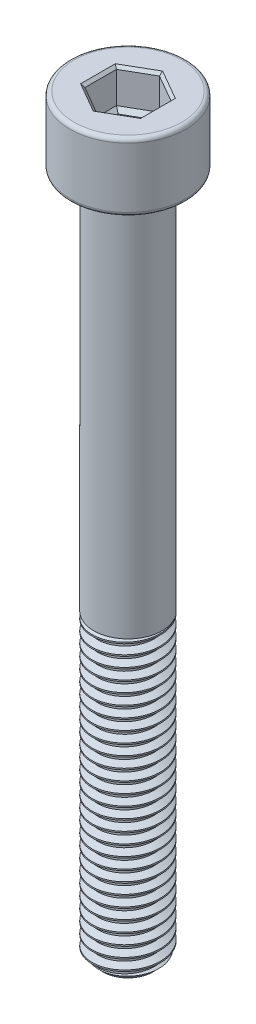
from build123d import *

# Parameters (mm, degrees)
SKETCH1_R           = 2.5
BOSS_EXTRUDE1_DEPTH = 22
THREAD1_PITCH       = 0.8
SKETCH2_R           = 2.5
BOSS_EXTRUDE2_DEPTH = 28
SKETCH3_R           = 4.25
BOSS_EXTRUDE3_DEPTH = 5
FILLET1_R           = 0.3
CUT_EXTRUDE1_DEPTH  = 2.5
CHAMFER1_SIZE       = 0.2
CUT_EXTRUDE2_DEPTH  = 0.3
CUT_EXTRUDE2_DRAFT  = -45


with BuildPart() as part:
    # Sketch1 → Boss-Extrude1 (new body)
    with BuildSketch(Plane(origin=(0, 0, 0), x_dir=(1, 0, 0), z_dir=(0, 1, 0))):
        with Locations(Location((0, 0, 0), (0, 0, 270))):
            Circle(SKETCH1_R)
    extrude(amount=BOSS_EXTRUDE1_DEPTH)

    # Thread1: the profile of Thread Profile1 profile screwed along a right-hand helix of 28.75 turns, 8 arcs to a turn; built about Z, then put on its axis
    thread1_z = Axis((0, 0, 0), (0, 0, 1))
    thread1_corners = [(2.5003, 0, -0.000173205), (2.5003, 0, 0.700173203), (2.0669873, 0, 0.449999999), (2.0669873, 0, 0.249999999)]
    with BuildLine(mode=Mode.PRIVATE) as thread1_profile:
        Line(thread1_corners[0], thread1_corners[1])
        Line(thread1_corners[1], thread1_corners[2])
        Line(thread1_corners[2], thread1_corners[3])
        Line(thread1_corners[3], thread1_corners[0])
    thread1_cap = Face(thread1_profile.wire())
    thread1_turn_angles = [0, 22.5, 45, 67.5, 90, 112.5, 135, 157.5, 180, 202.5, 225, 247.5, 270, 292.5, 315, 337.5, 360]
    thread1_turn_weights = [1, 0.9238795325112867, 1, 0.9238795325112867, 1, 0.9238795325112867, 1, 0.9238795325112867, 1, 0.9238795325112867, 1, 0.9238795325112867, 1, 0.9238795325112867, 1, 0.9238795325112867, 1]
    thread1_turn_rails = [Edge.make_bspline([Vector(p[0], p[1], 0).rotate(thread1_z, thread1_turn_angles[k]) / thread1_turn_weights[k] + Vector(0, 0, p[2] + THREAD1_PITCH * thread1_turn_angles[k] / 360) for k in range(17)], [0, 0, 0, 1, 1, 2, 2, 3, 3, 4, 4, 5, 5, 6, 6, 7, 7, 8, 8, 8], 2, thread1_turn_weights) for p in thread1_corners]
    thread1_turn_sides = [Face.make_surface_from_curves(thread1_turn_rails[p[0]], thread1_turn_rails[p[1]]) for p in [(0, 1), (1, 2), (2, 3), (3, 0)]]
    thread1_last_angles = [10080, 10102.5, 10125, 10147.5, 10170, 10192.5, 10215, 10237.5, 10260, 10282.5, 10305, 10327.5, 10350]
    thread1_last_weights = [1, 0.9238795325112867, 1, 0.9238795325112867, 1, 0.9238795325112867, 1, 0.9238795325112867, 1, 0.9238795325112867, 1, 0.9238795325112867, 1]
    thread1_last_rails = [Edge.make_bspline([Vector(p[0], p[1], 0).rotate(thread1_z, thread1_last_angles[k]) / thread1_last_weights[k] + Vector(0, 0, p[2] + THREAD1_PITCH * thread1_last_angles[k] / 360) for k in range(13)], [0, 0, 0, 1, 1, 2, 2, 3, 3, 4, 4, 5, 5, 6, 6, 6], 2, thread1_last_weights) for p in thread1_corners]
    thread1_last_sides = [Face.make_surface_from_curves(thread1_last_rails[p[0]], thread1_last_rails[p[1]]) for p in [(0, 1), (1, 2), (2, 3), (3, 0)]]
    thread1 = Plane(origin=(0, 23, 0), x_dir=(-1, 0, 0), z_dir=(0, -1, 0)) * Solid(Shell([*[p.moved(Location((0, 0, THREAD1_PITCH * i))) for i in range(28) for p in thread1_turn_sides], *thread1_last_sides, thread1_cap, thread1_cap.rotate(thread1_z, 10350).moved(Location((0, 0, THREAD1_PITCH * 10350 / 360)))]))
    add(thread1, mode=Mode.SUBTRACT)

    # Sketch2 → Boss-Extrude2 (add)
    with BuildSketch(Plane(origin=(0, 22, 0), x_dir=(1, 0, 0), z_dir=(0, 1, 0))):
        with Locations(Location((0, 0, 0), (0, 0, 90))):
            Circle(SKETCH2_R)
    extrude(amount=BOSS_EXTRUDE2_DEPTH)

    # Sketch3 → Boss-Extrude3 (add)
    with BuildSketch(Plane(origin=(0, 50, 0), x_dir=(1, 0, 0), z_dir=(0, 1, 0))):
        with Locations(Location((0, 0, 0), (0, 0, 270))):
            Circle(SKETCH3_R)
    extrude(amount=BOSS_EXTRUDE3_DEPTH)

    # Fillet1
    fillet1_edges = [part.edges().sort_by_distance(p)[0] for p in [
        (0, 50, -4.25),
        (0, 55, -4.25),
    ]]
    fillet(fillet1_edges, radius=FILLET1_R)

    # Sketch4 → Cut-Revolve1 (revolve, cut)
    with BuildSketch(Plane.XY, mode=Mode.PRIVATE) as cut_revolve1_sk:
        Polygon((2.51, 0), (2.51, 0.7), (1.81, 0), align=None)
    revolve(cut_revolve1_sk.sketch.rotate(Axis((0, 0, 0), (0, 1, 0)), 90), axis=Axis((0, 0, 0), (0, 1, 0)), mode=Mode.SUBTRACT)

    # Sketch5 → Cut-Extrude1 (cut)
    with BuildSketch(Plane(origin=(0, 55, 0), x_dir=(1, 0, 0), z_dir=(0, 1, 0))):
        Polygon((0, 2.309401077), (-2, 1.154700538), (-2, -1.154700538), (0, -2.309401077), (2, -1.154700538), (2, 1.154700538), align=None)
    extrude(amount=-CUT_EXTRUDE1_DEPTH, mode=Mode.SUBTRACT)

    # Chamfer1
    chamfer1_edges = [part.edges().sort_by_distance(p)[0] for p in [
        (1, 55, -1.732050808),
        (-1, 55, -1.732050808),
        (-2, 55, 0),
        (-1, 55, 1.732050808),
        (1, 55, 1.732050808),
        (2, 55, 0),
    ]]
    chamfer(chamfer1_edges, length=CHAMFER1_SIZE)


with BuildPart() as cut_extrude2_tool:
    # Sketch6 → Cut-Extrude2 (with draft: the straight prism first)
    with BuildSketch(Plane(origin=(0, 52.5, 0), x_dir=(1, 0, 0), z_dir=(0, 1, 0))):
        Polygon((0, 2.309401077), (-2, 1.154700538), (-2, -1.154700538), (0, -2.309401077), (2, -1.154700538), (2, 1.154700538), align=None)
    extrude(amount=-CUT_EXTRUDE2_DEPTH)
    # Cut-Extrude2: the draft: its side faces are tilted about the plane it starts from
    cut_extrude2_sides = [cut_extrude2_tool.faces().sort_by_distance(p)[0] for p in [
        (-1, 52.35, -1.732050808),
        (-2, 52.35, 0),
        (-1, 52.35, 1.732050808),
        (1, 52.35, 1.732050808),
        (2, 52.35, 0),
        (1, 52.35, -1.732050808),
    ]]
    draft(cut_extrude2_sides, Plane(origin=(0, 52.5, 0), x_dir=(1, 0, 0), z_dir=(0, 1, 0)), CUT_EXTRUDE2_DRAFT)


with BuildPart() as part_1:
    add(part.part)

    # Cut-Extrude2: cut by cut_extrude2_tool
    add(cut_extrude2_tool.part, mode=Mode.SUBTRACT)


solid = part_1.part
